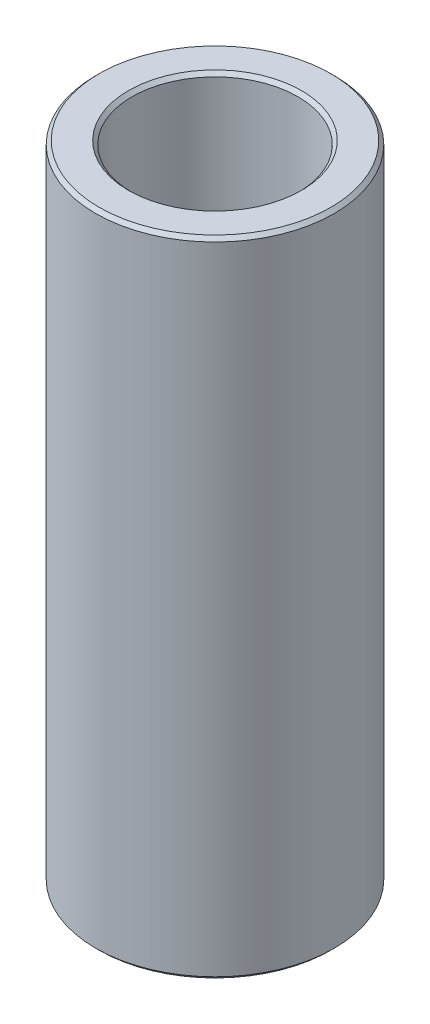
from build123d import *

# Parameters (mm, degrees)
SKETCH1_R           = 15
BOSS_EXTRUDE1_DEPTH = 80.855053611
SKETCH2_R           = 10.426178352
CUT_EXTRUDE1_DEPTH  = 84.591504917
CHAMFER1_SIZE       = 0.44564407


with BuildPart() as part:
    # Sketch1 → Boss-Extrude1 (new body)
    with BuildSketch(Plane(origin=(0, 0, 0), x_dir=(1, 0, 0), z_dir=(0, 1, 0))):
        Circle(SKETCH1_R)
    extrude(amount=BOSS_EXTRUDE1_DEPTH)

    # Sketch2 → Cut-Extrude1 (cut, through all)
    with BuildSketch(Plane(origin=(0, 0, 0), x_dir=(1, 0, 0), z_dir=(0, 1, 0))):
        Circle(SKETCH2_R)
    extrude(amount=CUT_EXTRUDE1_DEPTH, mode=Mode.SUBTRACT)

    # Chamfer1
    chamfer1_edges = [part.edges().sort_by_distance(p)[0] for p in [
        (-10.426178352, 80.855053611, 0),
        (-10.426178352, 0, 0),
        (-15, 0, 0),
        (-15, 80.855053611, 0),
    ]]
    chamfer(chamfer1_edges, length=CHAMFER1_SIZE)


solid = part.part
